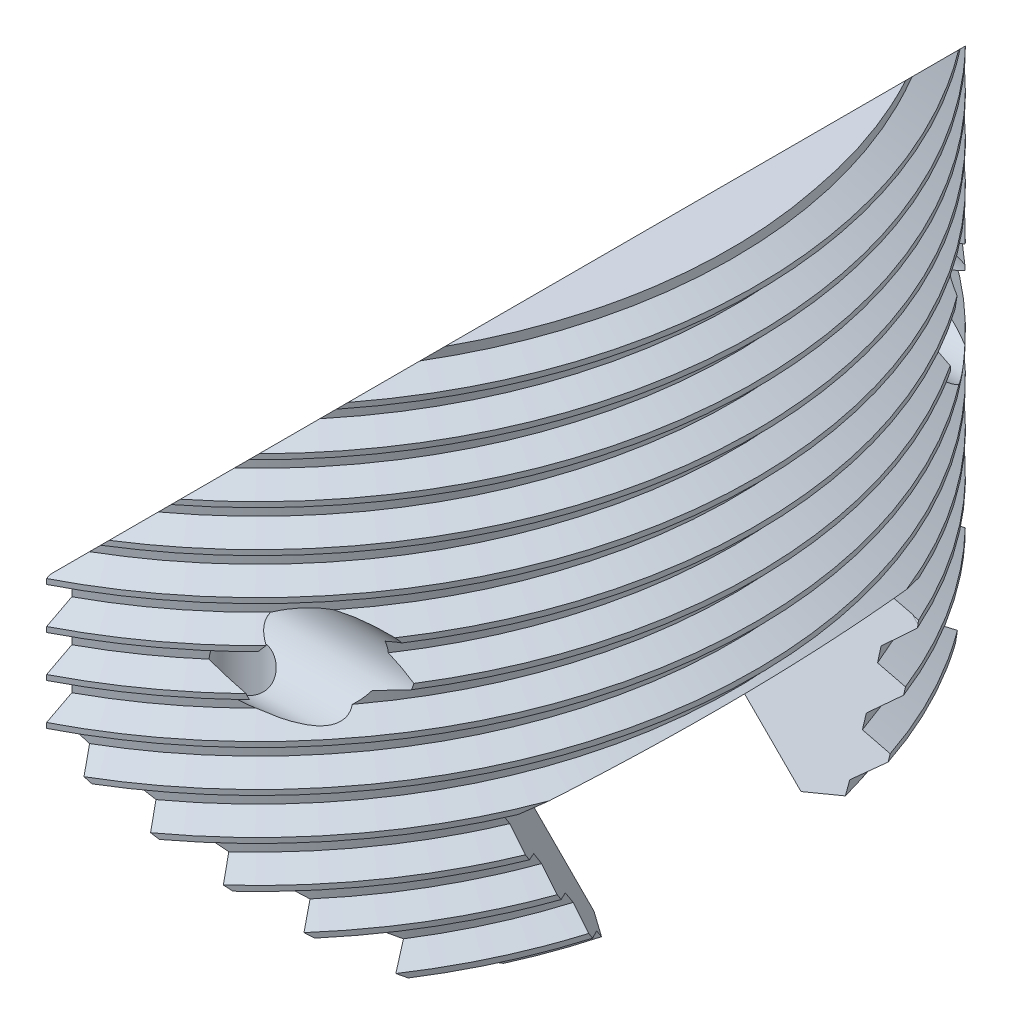
from build123d import *

# Parameters (mm, degrees)
SKETCH1_R                   = 25
BOSS_EXTRUDE1_DEPTH         = 28
THREAD1_PITCH               = 2.116666667
CUT_EXTRUDE1_DEPTH          = 47.86683315
CUT_EXTRUDE1_DEPTH_BACK     = 47.86683315
CUT_EXTRUDE2_DEPTH          = 28
CUT_EXTRUDE2_TAPER          = -30
TAP_DRILL_FOR_M5X0_8_TAP2_D = 4.2
CUT_EXTRUDE3_DEPTH          = 44.737856023
CUT_EXTRUDE3_DEPTH_BACK     = 44.737856023
SKETCH28_R                  = 1.5875
SKETCH29_R                  = 2.38125
CUT_EXTRUDE4_DEPTH          = 10
SKETCH30_R                  = 2.38125
CUT_EXTRUDE5_DEPTH          = 10


with BuildPart() as part:
    # Sketch1 → Boss-Extrude1 (new body)
    with BuildSketch(Plane(origin=(0, 0, 0), x_dir=(1, 0, 0), z_dir=(0, 1, 0))):
        with Locations(Location((0, 0, 0), (0, 0, 270))):
            Circle(SKETCH1_R)
    extrude(amount=BOSS_EXTRUDE1_DEPTH)

    # Thread1: the profile of Thread Profile1 profile screwed along a right-hand helix of 15.590551 turns, 10 arcs to a turn; built about Z, then put on its axis
    thread1_z = Axis((0, 0, 0), (0, 0, 1))
    thread1_corners = [(25.0003, 0, -0.000173205), (25.0003, 0, 1.852256533), (23.854320565, 0, 1.190624997), (23.854320565, 0, 0.66145833)]
    with BuildLine(mode=Mode.PRIVATE) as thread1_profile:
        Line(thread1_corners[0], thread1_corners[1])
        Line(thread1_corners[1], thread1_corners[2])
        Line(thread1_corners[2], thread1_corners[3])
        Line(thread1_corners[3], thread1_corners[0])
    thread1_cap = Face(thread1_profile.wire())
    thread1_turn_angles = [0, 18, 36, 54, 72, 90, 108, 126, 144, 162, 180, 198, 216, 234, 252, 270, 288, 306, 324, 342, 360]
    thread1_turn_weights = [1, 0.9510565162951535, 1, 0.9510565162951535, 1, 0.9510565162951535, 1, 0.9510565162951535, 1, 0.9510565162951535, 1, 0.9510565162951535, 1, 0.9510565162951535, 1, 0.9510565162951535, 1, 0.9510565162951535, 1, 0.9510565162951535, 1]
    thread1_turn_rails = [Edge.make_bspline([Vector(p[0], p[1], 0).rotate(thread1_z, thread1_turn_angles[k]) / thread1_turn_weights[k] + Vector(0, 0, p[2] + THREAD1_PITCH * thread1_turn_angles[k] / 360) for k in range(21)], [0, 0, 0, 1, 1, 2, 2, 3, 3, 4, 4, 5, 5, 6, 6, 7, 7, 8, 8, 9, 9, 10, 10, 10], 2, thread1_turn_weights) for p in thread1_corners]
    thread1_turn_sides = [Face.make_surface_from_curves(thread1_turn_rails[p[0]], thread1_turn_rails[p[1]]) for p in [(0, 1), (1, 2), (2, 3), (3, 0)]]
    thread1_last_angles = [5400, 5418, 5436, 5454, 5472, 5490, 5508, 5526, 5544, 5562, 5580, 5596.299212598, 5612.598425197]
    thread1_last_weights = [1, 0.9510565162951535, 1, 0.9510565162951535, 1, 0.9510565162951535, 1, 0.9510565162951535, 1, 0.9510565162951535, 1, 0.9598091490169673, 1]
    thread1_last_rails = [Edge.make_bspline([Vector(p[0], p[1], 0).rotate(thread1_z, thread1_last_angles[k]) / thread1_last_weights[k] + Vector(0, 0, p[2] + THREAD1_PITCH * thread1_last_angles[k] / 360) for k in range(13)], [0, 0, 0, 1, 1, 2, 2, 3, 3, 4, 4, 5, 5, 6, 6, 6], 2, thread1_last_weights) for p in thread1_corners]
    thread1_last_sides = [Face.make_surface_from_curves(thread1_last_rails[p[0]], thread1_last_rails[p[1]]) for p in [(0, 1), (1, 2), (2, 3), (3, 0)]]
    thread1 = Plane(origin=(0, -5, 0), x_dir=(1, 0, 0), z_dir=(0, 1, 0)) * Solid(Shell([*[p.moved(Location((0, 0, THREAD1_PITCH * i))) for i in range(15) for p in thread1_turn_sides], *thread1_last_sides, thread1_cap, thread1_cap.rotate(thread1_z, 5612.598425197).moved(Location((0, 0, THREAD1_PITCH * 5612.598425197 / 360)))]))
    add(thread1, mode=Mode.SUBTRACT)

    # SurfaceCut1
    split(bisect_by=Plane(origin=(11, 0, 0), x_dir=(0, 0, -1), z_dir=(1, 0, 0)), keep=Keep.TOP)

    # SurfaceCut2
    split(bisect_by=Plane(origin=(10.853553391, 10.853553391, 0), x_dir=(0, 0, -1), z_dir=(0.7071067811865464, 0.7071067811865488, 0)), keep=Keep.TOP)

    # SurfaceCut3
    split(bisect_by=Plane(origin=(-3.5, 3.5, 0), x_dir=(0, 0, 1), z_dir=(0.7071067811865464, -0.7071067811865488, 0)), keep=Keep.TOP)

    # Sketch7 → Cut-Extrude1 (cut, two sides: drawn at the far end of the back side and taken through both)
    with BuildSketch(Plane(origin=(10.5, -10.5, 0), x_dir=(0, 0, -1), z_dir=(0.7071067811865464, -0.7071067811865488, 0)).offset(-CUT_EXTRUDE1_DEPTH_BACK)):
        Polygon((0, 14.849242405), (4.775, 14.849242405), (10.078300859, 20.152543264), (0, 20.152543264), (-10.078300859, 20.152543264), (-4.775, 14.849242405), align=None)
    extrude(amount=CUT_EXTRUDE1_DEPTH + CUT_EXTRUDE1_DEPTH_BACK, mode=Mode.SUBTRACT)

    # Sketch8 → Cut-Extrude2 (cut)
    with BuildSketch(Plane(origin=(21.661382407, -0.126800529, -0.178664239), x_dir=(0.00824223881496715, -0.0009448174842200194, 0.9999655858174514), z_dir=(-0.9999488554797862, 0.005853460375612711, 0.00824763155682153))):
        Polygon((5.453733623, 0.131955631), (10.251176177, 6.850579788), (-9.906250352, 6.996822458), (-4.562128359, 0.204620978), align=None)
    extrude(amount=-CUT_EXTRUDE2_DEPTH, taper=CUT_EXTRUDE2_TAPER, mode=Mode.SUBTRACT)

    # Tap Drill for M5x0.8 Tap2 (through all)
    with Locations(Plane.ZY.offset(-11)):
        with Locations((-16, 14.353553391), (16, 14.353553391)):
            Hole(TAP_DRILL_FOR_M5X0_8_TAP2_D / 2)

    # Sketch28 → Cut-Extrude3 (cut, two sides: drawn at the far end of the back side and taken through both)
    with BuildSketch(Plane(origin=(0, 28, 0), x_dir=(1, 0, 0), z_dir=(0, 1, 0)).offset(-CUT_EXTRUDE3_DEPTH_BACK)):
        with Locations(Location((14, 16, 0), (0, 0, 270))):
            Circle(SKETCH28_R)
        with Locations(Location((14, -16, 0), (0, 0, 270))):
            Circle(SKETCH28_R)
    extrude(amount=CUT_EXTRUDE3_DEPTH + CUT_EXTRUDE3_DEPTH_BACK, mode=Mode.SUBTRACT)

    # Sketch29 → Cut-Extrude4 (cut)
    with BuildSketch(Plane.ZY.offset(-11)):
        with Locations((-16, 14.353553391)):
            Circle(SKETCH29_R)
    extrude(amount=-CUT_EXTRUDE4_DEPTH, mode=Mode.SUBTRACT)

    # Sketch30 → Cut-Extrude5 (cut)
    with BuildSketch(Plane.ZY.offset(-11)):
        with Locations((16, 14.353553391)):
            Circle(SKETCH30_R)
    extrude(amount=-CUT_EXTRUDE5_DEPTH, mode=Mode.SUBTRACT)


solid = part.part
